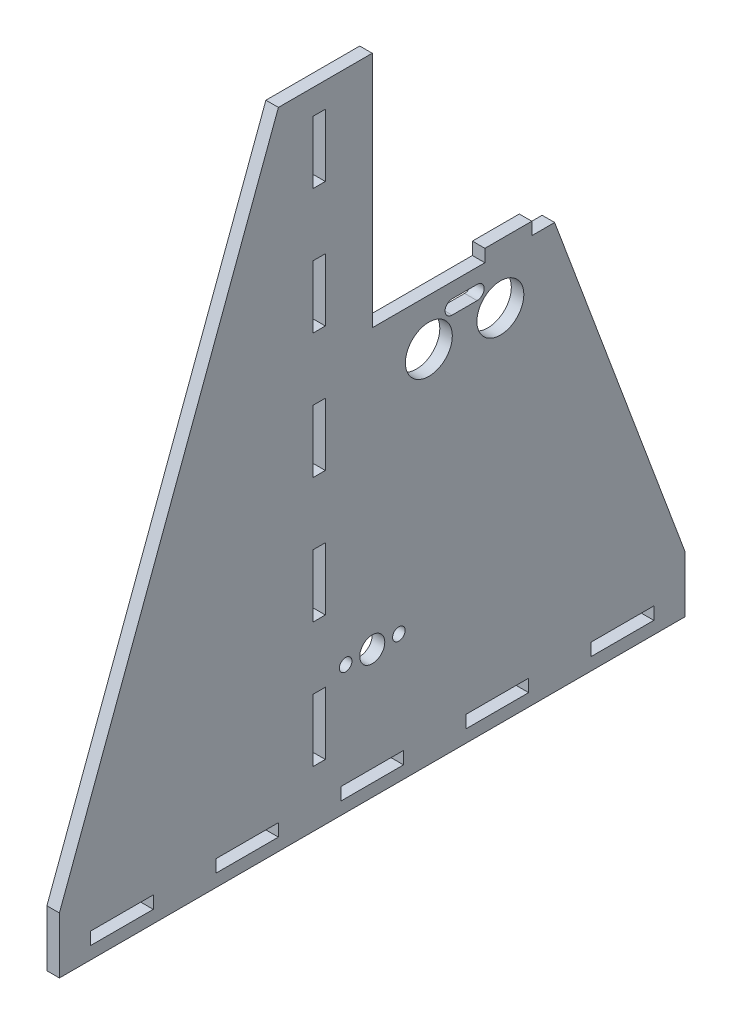
from build123d import *

# Parameters (mm, degrees)
SKICA1_R                = 4
SKICA1_W                = 20
SKICA1_H                = 4
SKICA1_W_2              = 4
SKICA1_H_2              = 20
SKICA1_R_2              = 2
SKICA1_R_3              = 7.5
P_IDAT_VYSUNUT_M1_DEPTH = 4


with BuildPart() as part:
    # Skica1 → Přidat vysunutím1 (new body)
    with BuildSketch(Plane(origin=(0, 0, 0), x_dir=(0, 0, -1), z_dir=(1, 0, 0))):
        Polygon((-100, 0), (100, 0), (100, 18), (58.29787234, 130), (51, 130), (51, 134), (36, 134), (36, 130), (0, 130), (0, 206), (-30, 206), (-100, 18), align=None)
        with Locations((0, 41)):
            Circle(SKICA1_R, mode=Mode.SUBTRACT)
        with Locations((0, 6)):
            Rectangle(SKICA1_W, SKICA1_H, mode=Mode.SUBTRACT)
        with Locations((-80, 6)):
            Rectangle(SKICA1_W, SKICA1_H, mode=Mode.SUBTRACT)
        with Locations((-40, 6)):
            Rectangle(SKICA1_W, SKICA1_H, mode=Mode.SUBTRACT)
        with Locations((-17, 28)):
            Rectangle(SKICA1_W_2, SKICA1_H_2, mode=Mode.SUBTRACT)
        with Locations((-8.5, 41)):
            Circle(SKICA1_R_2, mode=Mode.SUBTRACT)
        with Locations((-17, 68)):
            Rectangle(SKICA1_W_2, SKICA1_H_2, mode=Mode.SUBTRACT)
        with Locations((-17, 108)):
            Rectangle(SKICA1_W_2, SKICA1_H_2, mode=Mode.SUBTRACT)
        with Locations((-17, 148)):
            Rectangle(SKICA1_W_2, SKICA1_H_2, mode=Mode.SUBTRACT)
        with Locations((-17, 188)):
            Rectangle(SKICA1_W_2, SKICA1_H_2, mode=Mode.SUBTRACT)
        with BuildLine():
            Line((33.52225545, 120.75), (25.52225545, 120.75))
            ThreePointArc((25.52225545, 120.75), (23.27225545, 123), (25.52225545, 125.25))
            Line((25.52225545, 125.25), (33.52225545, 125.25))
            ThreePointArc((33.52225545, 125.25), (35.77225545, 123), (33.52225545, 120.75))
        make_face(mode=Mode.SUBTRACT)
        with Locations((40, 6)):
            Rectangle(SKICA1_W, SKICA1_H, mode=Mode.SUBTRACT)
        with Locations((8.5, 41)):
            Circle(SKICA1_R_2, mode=Mode.SUBTRACT)
        with Locations((80, 6)):
            Rectangle(SKICA1_W, SKICA1_H, mode=Mode.SUBTRACT)
        with Locations((18.09225545, 115)):
            Circle(SKICA1_R_3, mode=Mode.SUBTRACT)
        with Locations((40.95225545, 115)):
            Circle(SKICA1_R_3, mode=Mode.SUBTRACT)
    extrude(amount=P_IDAT_VYSUNUT_M1_DEPTH)


solid = part.part
